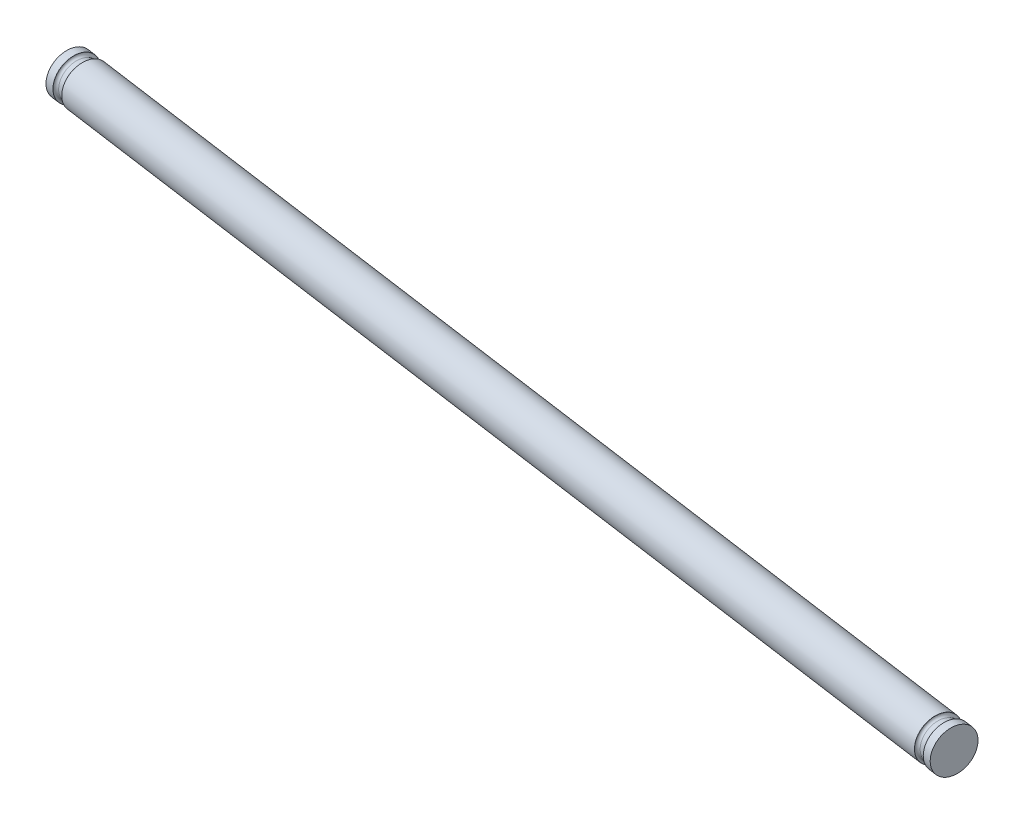
from build123d import *

# Parameters (mm, degrees)
BOSS_EXTRUDE1_START     = -134.1464368
BOSS_EXTRUDE1_OUTLINE_R = 3.90078125
BOSS_EXTRUDE1_DEPTH     = 184.396875
SKETCH40_W              = 3.35
SKETCH40_H              = 1.9
FILLET1_R               = 0.5


# Read off the part's stored shape, not the designer's step: Boss-Extrude1
with BuildPart() as part:
    # Boss-Extrude1 outline → Boss-Extrude1 (new body)
    with BuildSketch(Plane(origin=(0, 0, 0), x_dir=(0, 1, 0), z_dir=(0.9902680687415714, 0, 0.13917310096005805)).offset(BOSS_EXTRUDE1_START)):
        with Locations((-23.74921875, -363.03618928)):
            Circle(BOSS_EXTRUDE1_OUTLINE_R)
    extrude(amount=BOSS_EXTRUDE1_DEPTH)

    # Sketch40 → Revolve1 (revolve)
    with BuildSketch(Plane(origin=(0, -23.74921875, 0), x_dir=(-0.13917310096005797, 0, 0.9902680687415715), z_dir=(0, 1, 0)), mode=Mode.PRIVATE) as revolve1_sk:
        with Locations((-364.71118928, 51.2004382)):
            Rectangle(SKETCH40_W, SKETCH40_H)
        Polygon((-366.93697053, 52.1504382), (-366.38618928, 52.1504382), (-363.03618928, 52.1504382), (-363.03618928, 53.6504382), (-366.93697053, 53.6504382), align=None)
    revolve(revolve1_sk.sketch.rotate(Axis((-198147.883122307, -23.74921875, -28214.472842277), (0.9902680687415714, 0, 0.1391731009600579)), 180), axis=Axis((-198147.883122307, -23.74921875, -28214.472842277), (0.9902680687415714, 0, 0.1391731009600579)))

    # Fillet1
    fillet1_edges = [part.edges().sort_by_distance(p)[0] for p in [
        (100.752506501, -23.74921875, -355.827034763),
        (102.634015832, -23.74921875, -355.562605871),
    ]]
    fillet(fillet1_edges, radius=FILLET1_R)

    # Mirror2: part across plane


with BuildPart() as part_1:
    add(part.part)
    add(part.part.mirror(Plane(origin=(-41.539764254, 0, -5.838033142), x_dir=(-0.13917310096005794, 0, 0.9902680687415714), z_dir=(0.9902680687415714, 0, 0.13917310096005794))))


solid = part_1.part
